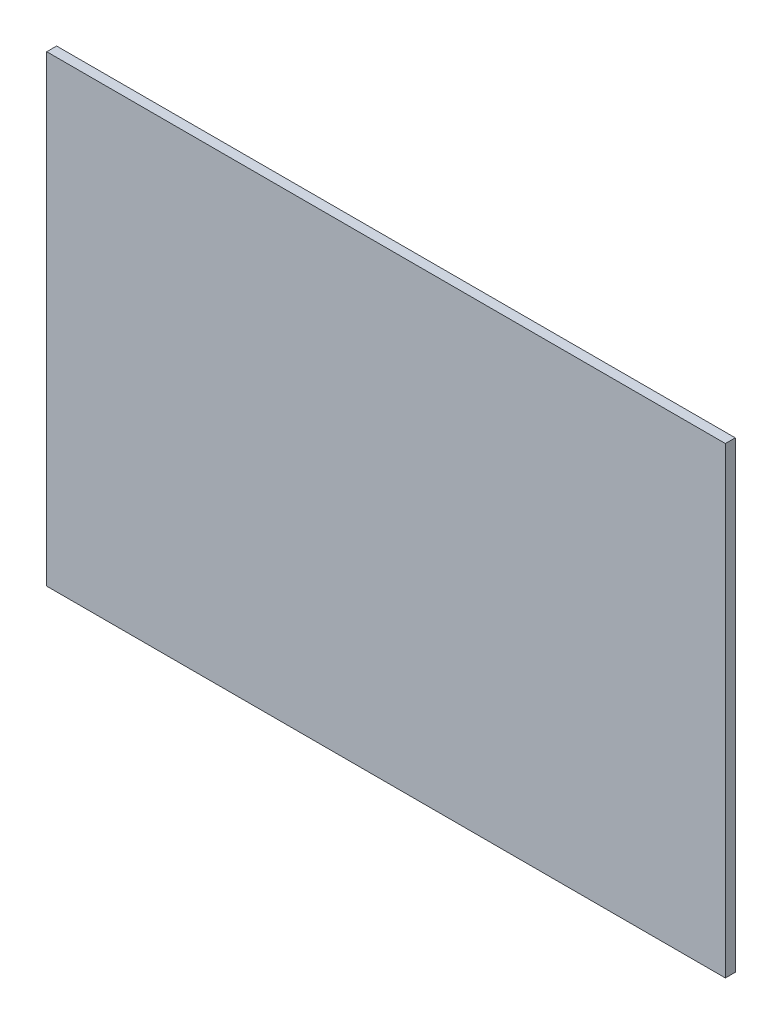
from build123d import *

# Parameters (mm, degrees)
SKETCH1_W           = 412
SKETCH1_H           = 281
BOSS_EXTRUDE1_DEPTH = 6


with BuildPart() as part:
    # Sketch1 → Boss-Extrude1 (new body)
    with BuildSketch(Plane.XY):
        with Locations((177.428571429, 117.604761905)):
            Rectangle(SKETCH1_W, SKETCH1_H)
    extrude(amount=BOSS_EXTRUDE1_DEPTH)


solid = part.part
